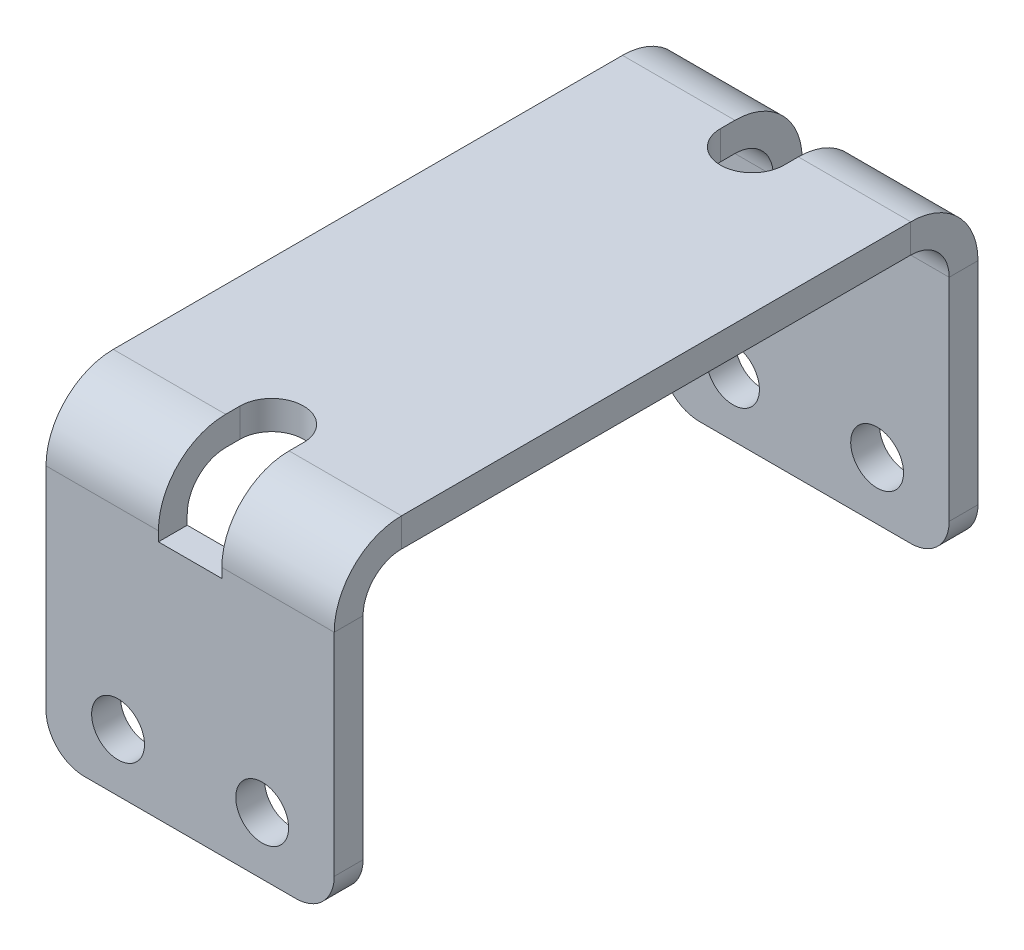
from build123d import *

# Parameters (mm, degrees)
ODGI_CIE_BAZOWE1_DEPTH     = 15
OTW_R_POD_RUB_M51_D        = 5.5
ZAOKR_GLENIE1_R            = 4
OTW_R_POD_RUB_M61_D        = 6.6
WYTNIJ_WYCI_GNI_CIE2_START = -8
WYTNIJ_WYCI_GNI_CIE2_DEPTH = 8


# Sheet-metal steps are written as plain solids
with BuildPart() as part:
    # Szkic1 → Odgięcie bazowe1 (new, symmetric)
    with BuildSketch(Plane(origin=(0, 0, 0), x_dir=(0, 0, -1), z_dir=(1, 0, 0))):
        with BuildLine():
            Line((-30.5, -30), (-30.5, -4))
            ThreePointArc((-30.5, -4), (-29.328427125, -1.171572875), (-26.5, 0))
            Line((-26.5, 0), (26.5, 0))
            ThreePointArc((26.5, 0), (29.328427125, -1.171572875), (30.5, -4))
            Line((30.5, -4), (30.5, -30))
            Line((30.5, -30), (33.5, -30))
            Line((33.5, -30), (33.5, -4))
            ThreePointArc((33.5, -4), (31.449747468, 0.949747468), (26.5, 3))
            Line((26.5, 3), (-26.5, 3))
            ThreePointArc((-26.5, 3), (-31.449747468, 0.949747468), (-33.5, -4))
            Line((-33.5, -4), (-33.5, -30))
            Line((-33.5, -30), (-30.5, -30))
        make_face()
    extrude(amount=ODGI_CIE_BAZOWE1_DEPTH, both=True)

    # Otwór pod śrubę M51 (through all)
    with Locations(Plane.XY.offset(33.5)):
        with Locations((-7.5, -24), (7.5, -24)):
            Hole(OTW_R_POD_RUB_M51_D / 2)

    # Zaokrąglenie1
    zaokr_glenie1_edges = [part.edges().sort_by_distance(p)[0] for p in [
        (15, -30, -32),
        (15, -30, 32),
        (-15, -30, -32),
        (-15, -30, 32),
    ]]
    fillet(zaokr_glenie1_edges, radius=ZAOKR_GLENIE1_R)

    # Otwór pod śrubę M61 (through all)
    with Locations(Plane(origin=(0, 3, 0), x_dir=(1, 0, 0), z_dir=(0, 1, 0))):
        with Locations((0, 25), (0, -25)):
            Hole(OTW_R_POD_RUB_M61_D / 2)

    # Szkic10 → Wytnij-wyciągnięcie2 (cut)
    with BuildSketch(Plane(origin=(0, 3, 0), x_dir=(1, 0, 0), z_dir=(0, 1, 0)).offset(WYTNIJ_WYCI_GNI_CIE2_START)):
        with BuildLine():
            Line((-3.3, 25), (-3.3, 33.5))
            ThreePointArc((-3.3, 33.5), (0, 36.8), (3.3, 33.5))
            Line((3.3, 33.5), (3.3, 25))
            ThreePointArc((3.3, 25), (0, 21.7), (-3.3, 25))
        make_face()
        with BuildLine():
            Line((-3.3, -25), (-3.3, -33.5))
            ThreePointArc((-3.3, -33.5), (0, -36.8), (3.3, -33.5))
            Line((3.3, -33.5), (3.3, -25))
            ThreePointArc((3.3, -25), (0, -21.7), (-3.3, -25))
        make_face()
    extrude(amount=WYTNIJ_WYCI_GNI_CIE2_DEPTH, mode=Mode.SUBTRACT)


solid = part.part
